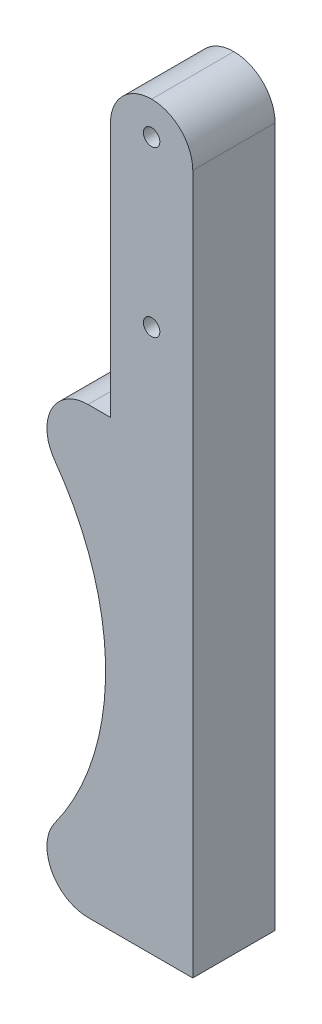
from build123d import *

# Parameters (mm, degrees)
ESQUISSE1_W             = 10
ESQUISSE1_H             = 90
BOSS_EXTRU_1_DEPTH      = 10
ESQUISSE2_R             = 1
ENL_V_MAT_EXTRU_1_DEPTH = 10
CONG_1_R                = 5
BOSS_EXTRU_2_DEPTH      = 10
CONG_2_R                = 5


with BuildPart() as part:
    # Esquisse1 → Boss.-Extru.1 (new body)
    with BuildSketch(Plane.XY):
        with Locations((5, 45)):
            Rectangle(ESQUISSE1_W, ESQUISSE1_H)
    extrude(amount=BOSS_EXTRU_1_DEPTH)

    # Esquisse2 → Enlèv. mat.-Extru.1 (cut)
    with BuildSketch(Plane.XY.offset(10)):
        with Locations((5, 66)):
            Circle(ESQUISSE2_R)
        with Locations((5, 86)):
            Circle(ESQUISSE2_R)
    extrude(amount=-ENL_V_MAT_EXTRU_1_DEPTH, mode=Mode.SUBTRACT)

    # Congé1
    cong_1_edges = [part.edges().sort_by_distance(p)[0] for p in [
        (10, 90, 5),
        (0, 90, 5),
    ]]
    fillet(cong_1_edges, radius=CONG_1_R - 0.0001)  # a hair under: the kernel refuses the full size

    # Esquisse3 → Boss.-Extru.2 (add)
    with BuildSketch(Plane.XY.offset(10)):
        with BuildLine():
            Line((0, 0), (0, 54))
            Line((0, 54), (-15, 54))
            ThreePointArc((-15, 54), (-0.590052515, 27), (-15, 0))
            Line((-15, 0), (0, 0))
        make_face()
    extrude(amount=-BOSS_EXTRU_2_DEPTH)

    # Congé2
    cong_2_edges = [part.edges().sort_by_distance(p)[0] for p in [
        (-15, 0, 5),
        (-15, 54, 5),
    ]]
    fillet(cong_2_edges, radius=CONG_2_R)


solid = part.part
